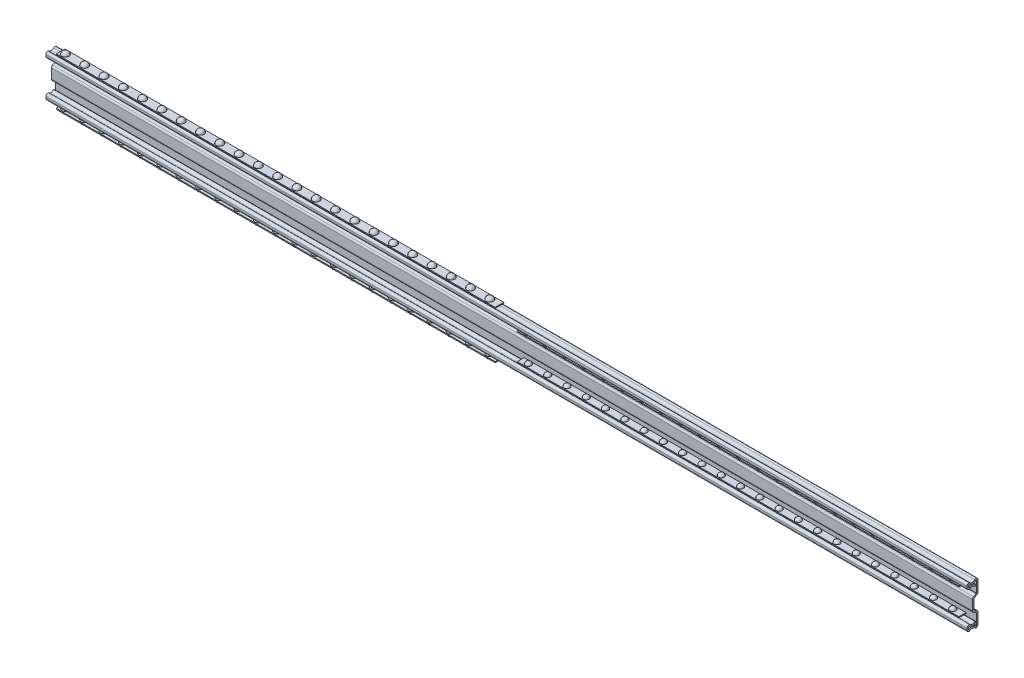
from build123d import *
from build123d.topology import SkipClean

# Parameters (mm, degrees)
EXTRUDE_THIN1_START     = -609.6
EXTRUDE_THIN1_DEPTH     = 1219.2
EXTRUDE_THIN2_DEPTH     = 1212.85
EXTRUDE_THIN5_START     = -1216.66
EXTRUDE_THIN5_DEPTH     = 1216.66
CUT_EXTRUDE1_DEPTH      = 1830.230661576
CUT_EXTRUDE1_DEPTH_BACK = 1830.230661576
SKETCH6_W               = 12.7
SKETCH6_H               = 12.7
SKETCH9_W               = 2.3622
SKETCH9_H               = 13.3858
EXTRUDE1_DEPTH          = 25.4
FILLET1_R               = 1.016
FILLET2_R               = 3.3782
CUT_EXTRUDE2_DEPTH      = 2.3622
SKETCH2_R               = 2.5781
SKETCH2_R_2             = 3.302
CUT_EXTRUDE12_DEPTH     = 2.3622
SKETCH22_R              = 2.5781
SKETCH22_R_2            = 3.302
SKETCH22_R_3            = 3.5687
CUT_EXTRUDE13_DEPTH     = 2.3622
SKETCH23_R              = 2.5781
SKETCH23_R_2            = 3.302
CUT_EXTRUDE14_DEPTH     = 2.3622
SKETCH24_R              = 2.5781
SKETCH24_R_2            = 3.302
CUT_EXTRUDE15_DEPTH     = 2.3622
SKETCH25_R              = 2.5781
SKETCH25_R_2            = 3.302
CUT_EXTRUDE16_DEPTH     = 2.3622
SKETCH27_R              = 3.5687
CUT_E_DEPTH             = 2.3622
SKETCH28_R              = 3.302
CUT_F_DEPTH             = 2.3622
SKETCH29_R              = 2.5781
CUT_EXTRUDE18_DEPTH     = 2.3622
CUT_H_DEPTH             = 2.3622
CUT_J_DEPTH             = 2.3622
SKETCH32_R              = 2.5781
SKETCH32_R_2            = 3.302
CUT_EXTRUDE21_DEPTH     = 2.3622
SKETCH210_R             = 2.5781
SKETCH210_R_2           = 3.302
CUT_EXTRUDE19_DEPTH     = 2.3622
SKETCH211_R             = 2.5781
SKETCH211_R_2           = 3.302
CUT_EXTRUDE110_DEPTH    = 2.3622
SKETCH212_R             = 2.5781
SKETCH212_R_2           = 3.302
CUT_EXTRUDE111_DEPTH    = 2.3622
SKETCH214_R             = 2.5781
SKETCH214_R_2           = 3.302
CUT_EXTRUDE113_DEPTH    = 2.3622
SKETCH215_R             = 3.302
CUT_EXTRUDE114_DEPTH    = 2.3622
CUT_R_DEPTH             = 2.3622
LPATTERN1_COUNT         = 23
LPATTERN1_PITCH         = 25.4
EXTRUDE2_DEPTH          = 12.7
EXTRUDE2_DEPTH_BACK     = 565.15
SKETCH218_W             = 11.43
SKETCH218_H             = 1.27
LPATTERN2_COUNT         = 23
LPATTERN2_PITCH         = 25.4
EXTRUDE3_DEPTH          = 12.7
EXTRUDE3_DEPTH_BACK     = 568.96
SKETCH220_W             = 9.245599771
SKETCH220_H             = 1.27


# Read off the part's stored shape, not the designer's step: Extrude-Thin1, Extrude-Thin5
with BuildPart() as part:
    # Extrude-Thin1 outline → Extrude-Thin1 (new body)
    with BuildSketch(Plane(origin=(0, 0, 0), x_dir=(0, 0, -1), z_dir=(1, 0, 0)).offset(EXTRUDE_THIN1_START)):
        with BuildLine():
            ThreePointArc((5.752462483, 35.334775085), (-0.647910774, 38.071449668), (-6.469678085, 34.255536805))
            Line((-6.469678085, 34.255536805), (-4.394919251, 33.126216382))
            ThreePointArc((-4.394919251, 33.126216382), (-0.440132491, 35.718405464), (3.907707273, 33.85935411))
            ThreePointArc((3.907707273, 33.85935411), (4.993998236, 32.994951487), (6.347544809, 32.686517335))
            Line((6.347544809, 32.686517335), (7.175193262, 32.686517335))
            ThreePointArc((7.175193262, 32.686517335), (8.297725277, 32.22154935), (8.762693262, 31.099017335))
            Line((8.762693262, 31.099017335), (8.762693262, 0))
            Line((8.762693262, 0), (11.124893262, 0))
            Line((11.124893262, 0), (11.124893262, 31.099017335))
            ThreePointArc((11.124893262, 31.099017335), (9.968052916, 33.891876989), (7.175193262, 35.048717335))
            Line((7.175193262, 35.048717335), (6.347544809, 35.048717335))
            ThreePointArc((6.347544809, 35.048717335), (6.017411498, 35.123945177), (5.752462483, 35.334775085))
        make_face()
    extrude(amount=EXTRUDE_THIN1_DEPTH)

    # Sketch6 → Cut-Extrude1 (cut, two sides: drawn at the far end of the back side and taken through both)
    with BuildSketch(Plane.XY.offset(-CUT_EXTRUDE1_DEPTH_BACK)):
        with Locations((-603.25, 31.75)):
            Rectangle(SKETCH6_W, SKETCH6_H)
    extrude(amount=CUT_EXTRUDE1_DEPTH + CUT_EXTRUDE1_DEPTH_BACK, mode=Mode.SUBTRACT)

    # Sketch9 → Extrude1 (add)
    with BuildSketch(Plane(origin=(0, 25.4, 0), x_dir=(-1, 0, 0), z_dir=(0, 1, 0))):
        with Locations((608.4189, -2.069793262)):
            Rectangle(SKETCH9_W, SKETCH9_H)
    extrude(amount=-EXTRUDE1_DEPTH)

    # Fillet1
    fillet1_edges = [part.edges().sort_by_distance(p)[0] for p in [
        (-607.2378, 12.7, -8.762693262),
    ]]
    fillet(fillet1_edges, radius=FILLET1_R)

    # Fillet2
    fillet2_edges = [part.edges().sort_by_distance(p)[0] for p in [
        (-609.6, 12.7, -11.124893262),
    ]]
    fillet(fillet2_edges, radius=FILLET2_R)

    # Sketch32 → Cut-Extrude21 (cut)
    with BuildSketch(Plane.XY.offset(-8.762693262)):
        with Locations((596.9, 0)):
            Circle(SKETCH32_R)
        with Locations((577.85, 0)):
            Circle(SKETCH32_R_2)
        with Locations((520.7, 0)):
            Circle(SKETCH32_R_2)
        with Locations((533.4, 0)):
            Circle(SKETCH32_R)
        with BuildLine():
            Line((549.148, 0), (561.848, 0))
            ThreePointArc((561.848, 0), (560.880866591, 2.334866591), (558.546, 3.302))
            Line((558.546, 3.302), (552.45, 3.302))
            ThreePointArc((552.45, 3.302), (550.115133409, 2.334866591), (549.148, 0))
        make_face()
    extrude(amount=-CUT_EXTRUDE21_DEPTH, mode=Mode.SUBTRACT)

    # Sketch210 → Cut-Extrude19 (cut)
    with BuildSketch(Plane(origin=(-677.249248887, 14.903736783, -8.762693262), x_dir=(1, 0, 0), z_dir=(0, 0, 1))):
        with Locations((1051.899248887, -14.903736783)):
            Circle(SKETCH210_R)
        with Locations((1039.199248887, -14.903736783)):
            Circle(SKETCH210_R_2)
    extrude(amount=-CUT_EXTRUDE19_DEPTH, mode=Mode.SUBTRACT)

    # Sketch211 → Cut-Extrude110 (cut)
    with BuildSketch(Plane(origin=(-447.985498291, 15.81613418, -8.762693262), x_dir=(1, 0, 0), z_dir=(0, 0, 1))):
        with Locations((460.685498291, -15.81613418)):
            Circle(SKETCH211_R)
        with Locations((447.985498291, -15.81613418)):
            Circle(SKETCH211_R_2)
    extrude(amount=-CUT_EXTRUDE110_DEPTH, mode=Mode.SUBTRACT)

    # Sketch212 → Cut-Extrude111 (cut)
    with BuildSketch(Plane(origin=(250.194594693, 14.477181682, -8.762693262), x_dir=(1, 0, 0), z_dir=(0, 0, 1))):
        with Locations((-599.444594693, -14.477181682)):
            Circle(SKETCH212_R)
        with Locations((-612.144594693, -14.477181682)):
            Circle(SKETCH212_R_2)
    extrude(amount=-CUT_EXTRUDE111_DEPTH, mode=Mode.SUBTRACT)

    # Sketch214 → Cut-Extrude113 (cut)
    with BuildSketch(Plane(origin=(529.798432462, 18.139402612, -8.762693262), x_dir=(1, 0, 0), z_dir=(0, 0, 1))):
        with Locations((-1066.500432462, -18.139402612)):
            Circle(SKETCH214_R)
        with Locations((-1079.200432462, -18.139402612)):
            Circle(SKETCH214_R_2)
        with BuildLine():
            Line((-1044.148432462, -18.139402612), (-1056.848432462, -18.139402612))
            ThreePointArc((-1056.848432462, -18.139402612), (-1055.881299054, -15.80453602), (-1053.546432462, -14.837402612))
            Line((-1053.546432462, -14.837402612), (-1047.450432462, -14.837402612))
            ThreePointArc((-1047.450432462, -14.837402612), (-1045.115565871, -15.80453602), (-1044.148432462, -18.139402612))
        make_face()
    extrude(amount=-CUT_EXTRUDE113_DEPTH, mode=Mode.SUBTRACT)

    # Sketch215 → Cut-Extrude114 (cut)
    with BuildSketch(Plane(origin=(674.3557152, 11.320285871, -8.762693262), x_dir=(1, 0, 0), z_dir=(0, 0, 1))):
        with Locations((-1252.2057152, -11.320285871)):
            Circle(SKETCH215_R)
    extrude(amount=-CUT_EXTRUDE114_DEPTH, mode=Mode.SUBTRACT)

    # Sketch216 → Cut R (cut)
    with BuildSketch(Plane.XY.offset(-8.762693262)):
        with BuildLine():
            Line((-601.6625, 0), (-592.1375, 0))
            ThreePointArc((-592.1375, 0), (-592.892608007, 1.822991993), (-594.7156, 2.5781))
            Line((-594.7156, 2.5781), (-599.0844, 2.5781))
            ThreePointArc((-599.0844, 2.5781), (-600.907391993, 1.822991993), (-601.6625, 0))
        make_face()
    extrude(amount=-CUT_R_DEPTH, mode=Mode.SUBTRACT)

    # Mirror1 3: part across plane


with BuildPart() as body_2:
    # Sketch4 → Extrude-Thin2 (new body)
    with BuildSketch(Plane(origin=(1219.2, 0, 0), x_dir=(0, 0, -1), z_dir=(1, 0, 0))):
        with BuildLine():
            ThreePointArc((3.54024831, 19.789205828), (0.77024158, 21.457292879), (-2.36668079, 20.672965307))
            ThreePointArc((-2.36668079, 20.672965307), (-3.091811244, 20.294053258), (-3.898522237, 20.157649845))
            ThreePointArc((-3.898522237, 20.157649845), (-5.766174756, 20.914093138), (-6.542172842, 22.773705828))
            Line((-6.542172842, 22.773705828), (-6.542172842, 25.161305828))
            ThreePointArc((-6.542172842, 25.161305828), (-5.766174756, 27.020918518), (-3.898522237, 27.77736181))
            ThreePointArc((-3.898522237, 27.77736181), (-3.659975019, 27.729624759), (-3.455361804, 27.598030559))
            ThreePointArc((-3.455361804, 27.598030559), (-0.023095262, 26.226172038), (3.414460302, 27.584723163))
            ThreePointArc((3.414460302, 27.584723163), (6.244879756, 28.080225918), (7.822893148, 25.678836527))
            Line((7.822893148, 25.678836527), (7.822893148, 11.408756936))
            ThreePointArc((7.822893148, 11.408756936), (7.431553352, 9.948256936), (6.362393148, 8.879096732))
            Line((6.362393148, 8.879096732), (3.123893148, 7.009347885))
            ThreePointArc((3.123893148, 7.009347885), (2.84498179, 6.730436527), (2.742893148, 6.349436527))
            Line((2.742893148, 6.349436527), (2.742893148, 0))
            Line((2.742893148, 0), (0.583893148, 0))
            Line((0.583893148, 0), (0.583893148, 6.349436527))
            ThreePointArc((0.583893148, 6.349436527), (0.975232943, 7.809936527), (2.044393148, 8.879096732))
            Line((2.044393148, 8.879096732), (5.282893148, 10.748845578))
            ThreePointArc((5.282893148, 10.748845578), (5.561804505, 11.027756936), (5.663893148, 11.408756936))
            Line((5.663893148, 11.408756936), (5.663893148, 25.678836527))
            ThreePointArc((5.663893148, 25.678836527), (5.388123817, 26.098496809), (4.893487408, 26.011904095))
            ThreePointArc((4.893487408, 26.011904095), (0.412345154, 24.079826794), (-4.266408016, 25.466487303))
            ThreePointArc((-4.266408016, 25.466487303), (-4.352985021, 25.324684037), (-4.383172842, 25.161305828))
            Line((-4.383172842, 25.161305828), (-4.383172842, 22.773705828))
            ThreePointArc((-4.383172842, 22.773705828), (-4.247561526, 22.448724969), (-3.921175649, 22.316530996))
            ThreePointArc((-3.921175649, 22.316530996), (-3.780197029, 22.340368486), (-3.653475202, 22.406586125))
            ThreePointArc((-3.653475202, 22.406586125), (1.089702598, 23.592527212), (5.278086268, 21.070299201))
            Line((5.278086268, 21.070299201), (3.54024831, 19.789205828))
        make_face()
    extrude(amount=-EXTRUDE_THIN2_DEPTH)

    # Mirror1: body 2 across plane


with BuildPart() as body_3:
    # Extrude-Thin5 outline → Extrude-Thin5 (new body)
    with BuildSketch(Plane(origin=(1828.8, 0, 0), x_dir=(0, 0, -1), z_dir=(1, 0, 0)).offset(EXTRUDE_THIN5_START)):
        with BuildLine():
            Line((-7.925106738, 0), (-5.562906738, 0))
            Line((-5.562906738, 0), (-5.562906738, 13.036209579))
            ThreePointArc((-5.562906738, 13.036209579), (-5.437890097, 13.255022954), (-5.185904431, 13.258440163))
            Line((-5.185904431, 13.258440163), (-2.932066495, 12.010964405))
            ThreePointArc((-2.932066495, 12.010964405), (1.369676528, 11.28348431), (5.180595526, 13.407423274))
            Line((5.180595526, 13.407423274), (3.41147618, 14.972736527))
            ThreePointArc((3.41147618, 14.972736527), (0.968956668, 13.611447462), (-1.788145038, 14.077708835))
            Line((-1.788145038, 14.077708835), (-4.041982973, 15.325184593))
            ThreePointArc((-4.041982973, 15.325184593), (-6.637435339, 15.28998734), (-7.925106738, 13.036209579))
            Line((-7.925106738, 13.036209579), (-7.925106738, 0))
        make_face()
    extrude(amount=EXTRUDE_THIN5_DEPTH)

    # Sketch10 → Cut-Extrude2 (cut)
    with BuildSketch(Plane.XY.offset(7.925106738)):
        with BuildLine():
            Line((1805.07005, 0), (1823.35805, 0))
            ThreePointArc((1823.35805, 0), (1814.21405, 9.144), (1805.07005, 0))
        make_face()
        with BuildLine():
            Line((1799.6281, 0), (1794.4719, 0))
            ThreePointArc((1794.4719, 0), (1797.05, 2.5781), (1799.6281, 0))
        make_face()
        with BuildLine():
            Line((1781.302, 0), (1774.698, 0))
            ThreePointArc((1774.698, 0), (1778, 3.302), (1781.302, 0))
        make_face()
        with BuildLine():
            Line((1762.252, 3.048), (1762.252, 0))
            Line((1762.252, 0), (1755.648, 0))
            Line((1755.648, 0), (1755.648, 3.048))
            ThreePointArc((1755.648, 3.048), (1758.95, 6.35), (1762.252, 3.048))
        make_face()
        with BuildLine():
            Line((1748.8281, 0), (1743.6719, 0))
            ThreePointArc((1743.6719, 0), (1746.25, 2.5781), (1748.8281, 0))
        make_face()
        with BuildLine():
            Line((1736.852, 0), (1730.248, 0))
            ThreePointArc((1730.248, 0), (1733.55, 3.302), (1736.852, 0))
        make_face()
    extrude(amount=-CUT_EXTRUDE2_DEPTH, mode=Mode.SUBTRACT)

    # Sketch2 → Cut-Extrude12 (cut)
    with BuildSketch(Plane(origin=(-2141.845428582, 6.157941778, 7.925106738), x_dir=(1, 0, 0), z_dir=(0, 0, 1))):
        with Locations((3824.595428582, -6.157941778)):
            Circle(SKETCH2_R)
        with Locations((3811.895428582, -6.157941778)):
            Circle(SKETCH2_R_2)
    extrude(amount=-CUT_EXTRUDE12_DEPTH, mode=Mode.SUBTRACT)

    # Sketch22 → Cut-Extrude13 (cut)
    with BuildSketch(Plane(origin=(-2143.135428603, 5.657950018, 7.925106738), x_dir=(1, 0, 0), z_dir=(0, 0, 1))):
        with Locations((3762.385428603, -5.657950018)):
            Circle(SKETCH22_R)
        with Locations((3730.635428603, -5.657950018)):
            Circle(SKETCH22_R_2)
        with Locations((3749.685428603, -5.657950018)):
            Circle(SKETCH22_R_3)
    extrude(amount=-CUT_EXTRUDE13_DEPTH, mode=Mode.SUBTRACT)

    # Sketch23 → Cut-Extrude14 (cut)
    with BuildSketch(Plane(origin=(-2022.429166167, 5.760053708, 7.925106738), x_dir=(1, 0, 0), z_dir=(0, 0, 1))):
        with Locations((3463.879166167, -5.760053708)):
            Circle(SKETCH23_R)
        with Locations((3451.179166167, -5.760053708)):
            Circle(SKETCH23_R_2)
    extrude(amount=-CUT_EXTRUDE14_DEPTH, mode=Mode.SUBTRACT)

    # Sketch24 → Cut-Extrude15 (cut)
    with BuildSketch(Plane(origin=(-1862.330020924, 7.905664942, 7.925106738), x_dir=(1, 0, 0), z_dir=(0, 0, 1))):
        with Locations((3151.380020924, -7.905664942)):
            Circle(SKETCH24_R)
        with Locations((3138.680020924, -7.905664942)):
            Circle(SKETCH24_R_2)
    extrude(amount=-CUT_EXTRUDE15_DEPTH, mode=Mode.SUBTRACT)

    # Sketch25 → Cut-Extrude16 (cut)
    with BuildSketch(Plane(origin=(-1718.369763818, 7.737387679, 7.925106738), x_dir=(1, 0, 0), z_dir=(0, 0, 1))):
        with Locations((2702.619763818, -7.737387679)):
            Circle(SKETCH25_R)
        with Locations((2689.919763818, -7.737387679)):
            Circle(SKETCH25_R_2)
    extrude(amount=-CUT_EXTRUDE16_DEPTH, mode=Mode.SUBTRACT)

    # Sketch27 → Cut E (cut)
    with BuildSketch(Plane.XY.offset(7.925106738)):
        with Locations((806.45, 0)):
            Circle(SKETCH27_R)
        with BuildLine():
            Line((796.8615, 0), (780.9865, 0))
            ThreePointArc((780.9865, 0), (781.953633409, 2.334866591), (784.2885, 3.302))
            Line((784.2885, 3.302), (793.5595, 3.302))
            ThreePointArc((793.5595, 3.302), (795.894366591, 2.334866591), (796.8615, 0))
        make_face()
    extrude(amount=-CUT_E_DEPTH, mode=Mode.SUBTRACT)

    # Sketch28 → Cut F (cut)
    with BuildSketch(Plane.XY.offset(7.925106738)):
        with Locations((728.726, 0)):
            Circle(SKETCH28_R)
    extrude(amount=-CUT_F_DEPTH, mode=Mode.SUBTRACT)

    # Sketch29 → Cut-Extrude18 (cut)
    with BuildSketch(Plane(origin=(-866.129297637, 5.417355799, 7.925106738), x_dir=(1, 0, 0), z_dir=(0, 0, 1))):
        with Locations((1582.155297637, -5.417355799)):
            Circle(SKETCH29_R)
        with BuildLine():
            Line((1574.217797637, -5.417355799), (1564.692797637, -5.417355799))
            ThreePointArc((1564.692797637, -5.417355799), (1565.659931046, -3.082489207), (1567.994797637, -2.115355799))
            Line((1567.994797637, -2.115355799), (1570.915797637, -2.115355799))
            ThreePointArc((1570.915797637, -2.115355799), (1573.250664228, -3.082489207), (1574.217797637, -5.417355799))
        make_face()
    extrude(amount=-CUT_EXTRUDE18_DEPTH, mode=Mode.SUBTRACT)

    # Sketch30 → Cut H (cut)
    with BuildSketch(Plane.XY.offset(7.925106738)):
        with BuildLine():
            Line((680.974, 0), (680.974, 3.048))
            ThreePointArc((680.974, 3.048), (684.276, 6.35), (687.578, 3.048))
            Line((687.578, 3.048), (687.578, 0))
            Line((687.578, 0), (680.974, 0))
        make_face()
    extrude(amount=-CUT_H_DEPTH, mode=Mode.SUBTRACT)

    # Sketch31 → Cut J (cut)
    with BuildSketch(Plane.XY.offset(7.925106738)):
        with BuildLine():
            Line((669.9885, 0), (660.4635, 0))
            ThreePointArc((660.4635, 0), (661.218608007, 1.822991993), (663.0416, 2.5781))
            Line((663.0416, 2.5781), (667.4104, 2.5781))
            ThreePointArc((667.4104, 2.5781), (669.233391993, 1.822991993), (669.9885, 0))
        make_face()
    extrude(amount=-CUT_J_DEPTH, mode=Mode.SUBTRACT)

    # Mirror1 2: body 3 across plane


with BuildPart() as body_2_1:
    add(body_2.part)
    add(body_2.part.mirror(Plane.ZX))


with BuildPart() as body_3_1:
    with SkipClean():  # the faces are left unmerged after this step: merging them gives an invalid solid
        add(body_3.part)
        add(body_3.part.mirror(Plane.ZX))


with BuildPart() as part_1:
    with SkipClean():  # the faces are left unmerged after this step: merging them gives an invalid solid
        add(part.part)
        add(part.part.mirror(Plane.ZX))


with BuildPart() as body_4:
    # Sketch217 → Revolve1 (revolve)
    with BuildSketch(Plane(origin=(584.2, 0, 0), x_dir=(0, 0, -1), z_dir=(1, 0, 0))):
        with BuildLine():
            Line((0, 35.7378), (0, 26.22652483))
            ThreePointArc((0, 26.22652483), (4.755637585, 30.982162415), (0, 35.7378))
        make_face()
    revolve(axis=Axis((584.2, 36.603094088, 0), (0, -1, 0)))


with BuildPart() as lpattern1_1:
    # LPattern1: pattern copy
    add(body_4.part.moved(Location(Vector(-1, 0, 0) * (1 * LPATTERN1_PITCH))))


with BuildPart() as lpattern1_2:
    # LPattern1: pattern copy
    add(body_4.part.moved(Location(Vector(-1, 0, 0) * (2 * LPATTERN1_PITCH))))


with BuildPart() as lpattern1_3:
    # LPattern1: pattern copy
    add(body_4.part.moved(Location(Vector(-1, 0, 0) * (3 * LPATTERN1_PITCH))))


with BuildPart() as lpattern1_4:
    # LPattern1: pattern copy
    add(body_4.part.moved(Location(Vector(-1, 0, 0) * (4 * LPATTERN1_PITCH))))


with BuildPart() as lpattern1_5:
    # LPattern1: pattern copy
    add(body_4.part.moved(Location(Vector(-1, 0, 0) * (5 * LPATTERN1_PITCH))))


with BuildPart() as lpattern1_6:
    # LPattern1: pattern copy
    add(body_4.part.moved(Location(Vector(-1, 0, 0) * (6 * LPATTERN1_PITCH))))


with BuildPart() as lpattern1_7:
    # LPattern1: pattern copy
    add(body_4.part.moved(Location(Vector(-1, 0, 0) * (7 * LPATTERN1_PITCH))))


with BuildPart() as lpattern1_8:
    # LPattern1: pattern copy
    add(body_4.part.moved(Location(Vector(-1, 0, 0) * (8 * LPATTERN1_PITCH))))


with BuildPart() as lpattern1_9:
    # LPattern1: pattern copy
    add(body_4.part.moved(Location(Vector(-1, 0, 0) * (9 * LPATTERN1_PITCH))))


with BuildPart() as lpattern1_10:
    # LPattern1: pattern copy
    add(body_4.part.moved(Location(Vector(-1, 0, 0) * (10 * LPATTERN1_PITCH))))


with BuildPart() as lpattern1_11:
    # LPattern1: pattern copy
    add(body_4.part.moved(Location(Vector(-1, 0, 0) * (11 * LPATTERN1_PITCH))))


with BuildPart() as lpattern1_12:
    # LPattern1: pattern copy
    add(body_4.part.moved(Location(Vector(-1, 0, 0) * (12 * LPATTERN1_PITCH))))


with BuildPart() as lpattern1_13:
    # LPattern1: pattern copy
    add(body_4.part.moved(Location(Vector(-1, 0, 0) * (13 * LPATTERN1_PITCH))))


with BuildPart() as lpattern1_14:
    # LPattern1: pattern copy
    add(body_4.part.moved(Location(Vector(-1, 0, 0) * (14 * LPATTERN1_PITCH))))


with BuildPart() as lpattern1_15:
    # LPattern1: pattern copy
    add(body_4.part.moved(Location(Vector(-1, 0, 0) * (15 * LPATTERN1_PITCH))))


with BuildPart() as lpattern1_16:
    # LPattern1: pattern copy
    add(body_4.part.moved(Location(Vector(-1, 0, 0) * (16 * LPATTERN1_PITCH))))


with BuildPart() as lpattern1_17:
    # LPattern1: pattern copy
    add(body_4.part.moved(Location(Vector(-1, 0, 0) * (17 * LPATTERN1_PITCH))))


with BuildPart() as lpattern1_18:
    # LPattern1: pattern copy
    add(body_4.part.moved(Location(Vector(-1, 0, 0) * (18 * LPATTERN1_PITCH))))


with BuildPart() as lpattern1_19:
    # LPattern1: pattern copy
    add(body_4.part.moved(Location(Vector(-1, 0, 0) * (19 * LPATTERN1_PITCH))))


with BuildPart() as lpattern1_20:
    # LPattern1: pattern copy
    add(body_4.part.moved(Location(Vector(-1, 0, 0) * (20 * LPATTERN1_PITCH))))


with BuildPart() as lpattern1_21:
    # LPattern1: pattern copy
    add(body_4.part.moved(Location(Vector(-1, 0, 0) * (21 * LPATTERN1_PITCH))))


with BuildPart() as lpattern1_22:
    # LPattern1: pattern copy
    add(body_4.part.moved(Location(Vector(-1, 0, 0) * (22 * LPATTERN1_PITCH))))


with BuildPart() as body_4_1:
    add(body_4.part)

    add(lpattern1_1.part)  # Extrude2 merges LPattern1_1

    add(lpattern1_2.part)  # Extrude2 merges LPattern1_2

    add(lpattern1_3.part)  # Extrude2 merges LPattern1_3

    add(lpattern1_4.part)  # Extrude2 merges LPattern1_4

    add(lpattern1_5.part)  # Extrude2 merges LPattern1_5

    add(lpattern1_6.part)  # Extrude2 merges LPattern1_6

    add(lpattern1_7.part)  # Extrude2 merges LPattern1_7

    add(lpattern1_8.part)  # Extrude2 merges LPattern1_8

    add(lpattern1_9.part)  # Extrude2 merges LPattern1_9

    add(lpattern1_10.part)  # Extrude2 merges LPattern1_10

    add(lpattern1_11.part)  # Extrude2 merges LPattern1_11

    add(lpattern1_12.part)  # Extrude2 merges LPattern1_12

    add(lpattern1_13.part)  # Extrude2 merges LPattern1_13

    add(lpattern1_14.part)  # Extrude2 merges LPattern1_14

    add(lpattern1_15.part)  # Extrude2 merges LPattern1_15

    add(lpattern1_16.part)  # Extrude2 merges LPattern1_16

    add(lpattern1_17.part)  # Extrude2 merges LPattern1_17

    add(lpattern1_18.part)  # Extrude2 merges LPattern1_18

    add(lpattern1_19.part)  # Extrude2 merges LPattern1_19

    add(lpattern1_20.part)  # Extrude2 merges LPattern1_20

    add(lpattern1_21.part)  # Extrude2 merges LPattern1_21

    add(lpattern1_22.part)  # Extrude2 merges LPattern1_22
    # Sketch218 → Extrude2 (add, two sides: drawn at the far end of the back side and taken through both)
    with BuildSketch(Plane(origin=(584.2, 0, 0), x_dir=(0, 0, -1), z_dir=(1, 0, 0)).offset(-EXTRUDE2_DEPTH_BACK)):
        with Locations((0, 30.9753)):
            Rectangle(SKETCH218_W, SKETCH218_H)
    extrude(amount=EXTRUDE2_DEPTH + EXTRUDE2_DEPTH_BACK)


with BuildPart() as body_5:
    # Sketch219 → Revolve2 (revolve)
    with BuildSketch(Plane(origin=(1193.8, 0, 0), x_dir=(0, 0, -1), z_dir=(1, 0, 0))):
        with BuildLine():
            Line((-0.000306852, 21.487836527), (-0.000306852, 13.550336527))
            ThreePointArc((-0.000306852, 13.550336527), (3.968443148, 17.519086527), (-0.000306852, 21.487836527))
        make_face()
    revolve(axis=Axis((1193.8, 22.284965157, 0.000306852), (0, -1, 0)))


with BuildPart() as lpattern2_1:
    # LPattern2: pattern copy
    add(body_5.part.moved(Location(Vector(-1, 0, 0) * (1 * LPATTERN2_PITCH))))


with BuildPart() as lpattern2_2:
    # LPattern2: pattern copy
    add(body_5.part.moved(Location(Vector(-1, 0, 0) * (2 * LPATTERN2_PITCH))))


with BuildPart() as lpattern2_3:
    # LPattern2: pattern copy
    add(body_5.part.moved(Location(Vector(-1, 0, 0) * (3 * LPATTERN2_PITCH))))


with BuildPart() as lpattern2_4:
    # LPattern2: pattern copy
    add(body_5.part.moved(Location(Vector(-1, 0, 0) * (4 * LPATTERN2_PITCH))))


with BuildPart() as lpattern2_5:
    # LPattern2: pattern copy
    add(body_5.part.moved(Location(Vector(-1, 0, 0) * (5 * LPATTERN2_PITCH))))


with BuildPart() as lpattern2_6:
    # LPattern2: pattern copy
    add(body_5.part.moved(Location(Vector(-1, 0, 0) * (6 * LPATTERN2_PITCH))))


with BuildPart() as lpattern2_7:
    # LPattern2: pattern copy
    add(body_5.part.moved(Location(Vector(-1, 0, 0) * (7 * LPATTERN2_PITCH))))


with BuildPart() as lpattern2_8:
    # LPattern2: pattern copy
    add(body_5.part.moved(Location(Vector(-1, 0, 0) * (8 * LPATTERN2_PITCH))))


with BuildPart() as lpattern2_9:
    # LPattern2: pattern copy
    add(body_5.part.moved(Location(Vector(-1, 0, 0) * (9 * LPATTERN2_PITCH))))


with BuildPart() as lpattern2_10:
    # LPattern2: pattern copy
    add(body_5.part.moved(Location(Vector(-1, 0, 0) * (10 * LPATTERN2_PITCH))))


with BuildPart() as lpattern2_11:
    # LPattern2: pattern copy
    add(body_5.part.moved(Location(Vector(-1, 0, 0) * (11 * LPATTERN2_PITCH))))


with BuildPart() as lpattern2_12:
    # LPattern2: pattern copy
    add(body_5.part.moved(Location(Vector(-1, 0, 0) * (12 * LPATTERN2_PITCH))))


with BuildPart() as lpattern2_13:
    # LPattern2: pattern copy
    add(body_5.part.moved(Location(Vector(-1, 0, 0) * (13 * LPATTERN2_PITCH))))


with BuildPart() as lpattern2_14:
    # LPattern2: pattern copy
    add(body_5.part.moved(Location(Vector(-1, 0, 0) * (14 * LPATTERN2_PITCH))))


with BuildPart() as lpattern2_15:
    # LPattern2: pattern copy
    add(body_5.part.moved(Location(Vector(-1, 0, 0) * (15 * LPATTERN2_PITCH))))


with BuildPart() as lpattern2_16:
    # LPattern2: pattern copy
    add(body_5.part.moved(Location(Vector(-1, 0, 0) * (16 * LPATTERN2_PITCH))))


with BuildPart() as lpattern2_17:
    # LPattern2: pattern copy
    add(body_5.part.moved(Location(Vector(-1, 0, 0) * (17 * LPATTERN2_PITCH))))


with BuildPart() as lpattern2_18:
    # LPattern2: pattern copy
    add(body_5.part.moved(Location(Vector(-1, 0, 0) * (18 * LPATTERN2_PITCH))))


with BuildPart() as lpattern2_19:
    # LPattern2: pattern copy
    add(body_5.part.moved(Location(Vector(-1, 0, 0) * (19 * LPATTERN2_PITCH))))


with BuildPart() as lpattern2_20:
    # LPattern2: pattern copy
    add(body_5.part.moved(Location(Vector(-1, 0, 0) * (20 * LPATTERN2_PITCH))))


with BuildPart() as lpattern2_21:
    # LPattern2: pattern copy
    add(body_5.part.moved(Location(Vector(-1, 0, 0) * (21 * LPATTERN2_PITCH))))


with BuildPart() as lpattern2_22:
    # LPattern2: pattern copy
    add(body_5.part.moved(Location(Vector(-1, 0, 0) * (22 * LPATTERN2_PITCH))))


with BuildPart() as body_5_1:
    add(body_5.part)

    add(lpattern2_1.part)  # Extrude3 merges LPattern2_1

    add(lpattern2_2.part)  # Extrude3 merges LPattern2_2

    add(lpattern2_3.part)  # Extrude3 merges LPattern2_3

    add(lpattern2_4.part)  # Extrude3 merges LPattern2_4

    add(lpattern2_5.part)  # Extrude3 merges LPattern2_5

    add(lpattern2_6.part)  # Extrude3 merges LPattern2_6

    add(lpattern2_7.part)  # Extrude3 merges LPattern2_7

    add(lpattern2_8.part)  # Extrude3 merges LPattern2_8

    add(lpattern2_9.part)  # Extrude3 merges LPattern2_9

    add(lpattern2_10.part)  # Extrude3 merges LPattern2_10

    add(lpattern2_11.part)  # Extrude3 merges LPattern2_11

    add(lpattern2_12.part)  # Extrude3 merges LPattern2_12

    add(lpattern2_13.part)  # Extrude3 merges LPattern2_13

    add(lpattern2_14.part)  # Extrude3 merges LPattern2_14

    add(lpattern2_15.part)  # Extrude3 merges LPattern2_15

    add(lpattern2_16.part)  # Extrude3 merges LPattern2_16

    add(lpattern2_17.part)  # Extrude3 merges LPattern2_17

    add(lpattern2_18.part)  # Extrude3 merges LPattern2_18

    add(lpattern2_19.part)  # Extrude3 merges LPattern2_19

    add(lpattern2_20.part)  # Extrude3 merges LPattern2_20

    add(lpattern2_21.part)  # Extrude3 merges LPattern2_21

    add(lpattern2_22.part)  # Extrude3 merges LPattern2_22
    # Sketch220 → Extrude3 (add, two sides: drawn at the far end of the back side and taken through both)
    with BuildSketch(Plane(origin=(1193.8, 0, 0), x_dir=(0, 0, -1), z_dir=(1, 0, 0)).offset(-EXTRUDE3_DEPTH_BACK)):
        with Locations((-0.000306853, 17.519086527)):
            Rectangle(SKETCH220_W, SKETCH220_H)
    extrude(amount=EXTRUDE3_DEPTH + EXTRUDE3_DEPTH_BACK)


with BuildPart() as body_6:
    # Mirror3: mirrored copy
    add(body_4_1.part.mirror(Plane.ZX))


with BuildPart() as body_7:
    # Mirror3 2: mirrored copy
    add(body_5_1.part.mirror(Plane.ZX))


solid = Compound([body_2_1.part, body_4_1.part, body_5_1.part, body_6.part, body_7.part])
